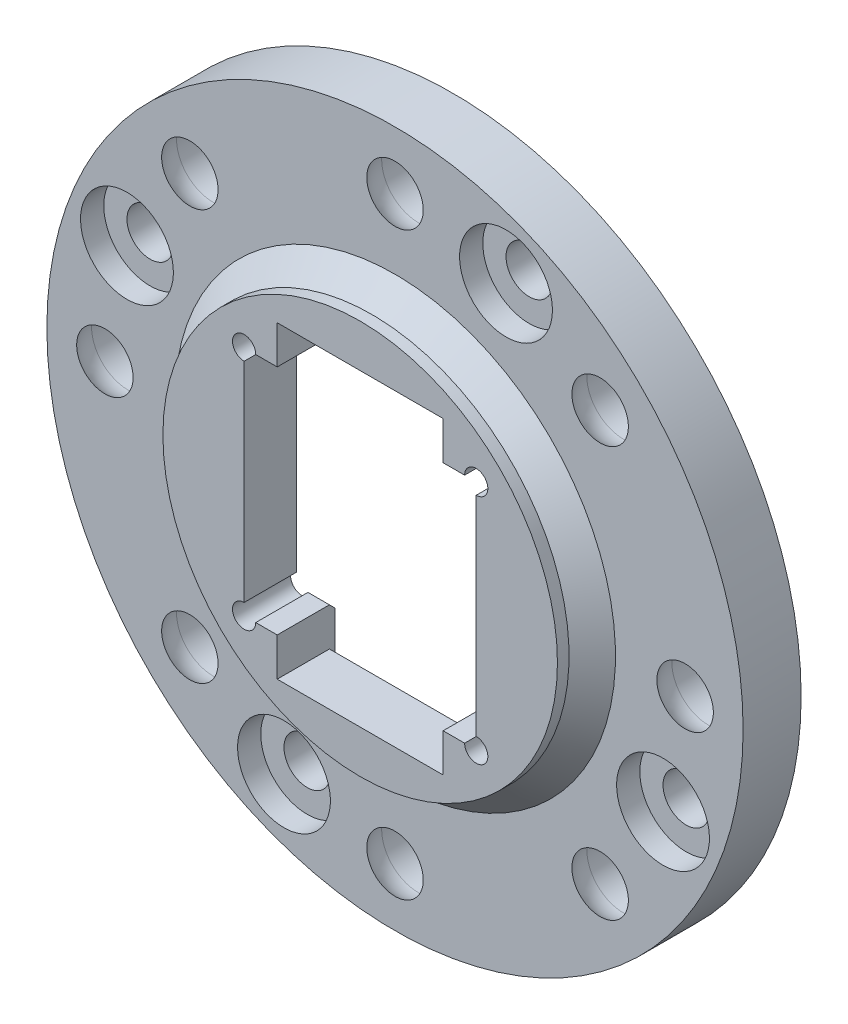
from build123d import *

# Parameters (mm, degrees)
SKETCH_1_R               = 17
EXTRUDE_1_DEPTH          = 5
SKETCH_2_R               = 30
SKETCH_2_R_2             = 17
EXTRUDE_2_DEPTH          = 2
EXTRUDE_START            = 3
SKETCH_3_R               = 30
SKETCH_3_R_2             = 20
EXTRUDE_3_DEPTH          = 3
CHAMFER_1_SIZE           = 2
PATTERN_CIRCULAR_1_COUNT = 8
SKETCH_6_R               = 4
CUT_EXTRUDE_1_DEPTH      = 2
SKETCH_7_R               = 2
CUT_EXTRUDE_2_DEPTH      = 43.720018727
PATTERN_CIRCULAR_2_COUNT = 4
CHAMFER_2_SIZE           = 0.5
CHAMFER_3_SIZE           = 3
SKETCH_8_W               = 27
SKETCH_8_H               = 3.3
CUT_EXTRUDE_3_DEPTH      = 43.720018727


with BuildPart() as part:
    # 草图1 → 凸台-拉伸1 (new body)
    with BuildSketch(Plane.XY):
        Circle(SKETCH_1_R)
        with BuildLine():
            ThreePointArc((-10, 9), (-10.707106781, 10.707106781), (-9, 10))
            Line((-9, 10), (-7.15, 10))
            Line((-7.15, 10), (-7.15, 13.3))
            Line((-7.15, 13.3), (7.15, 13.3))
            Line((7.15, 13.3), (7.15, 10))
            Line((7.15, 10), (9, 10))
            ThreePointArc((9, 10), (10, 11), (11, 10))
            ThreePointArc((11, 10), (10.707106781, 9.292893219), (10, 9))
            Line((10, 9), (10, -9))
            ThreePointArc((10, -9), (10.707106781, -9.292893219), (11, -10))
            ThreePointArc((11, -10), (10, -11), (9, -10))
            Line((9, -10), (7.15, -10))
            Line((7.15, -10), (7.15, -13.3))
            Line((7.15, -13.3), (-7.15, -13.3))
            Line((-7.15, -13.3), (-7.15, -10))
            Line((-7.15, -10), (-9, -10))
            ThreePointArc((-9, -10), (-10.707106781, -10.707106781), (-10, -9))
            Line((-10, -9), (-10, 9))
        make_face(mode=Mode.SUBTRACT)
    extrude(amount=EXTRUDE_1_DEPTH)

    # 草图2 → 凸台-拉伸2 (add)
    with BuildSketch(Plane(origin=(0, 0, 0), x_dir=(-1, 0, 0), z_dir=(0, 0, -1))):
        Circle(SKETCH_2_R)
        Circle(SKETCH_2_R_2, mode=Mode.SUBTRACT)
    extrude(amount=-EXTRUDE_2_DEPTH)

    # 草图3 → 凸台-拉伸3 (add)
    with BuildSketch(Plane(origin=(0, 0, 0), x_dir=(-1, 0, 0), z_dir=(0, 0, -1)).offset(EXTRUDE_START)):
        Circle(SKETCH_3_R)
        Circle(SKETCH_3_R_2, mode=Mode.SUBTRACT)
    extrude(amount=-EXTRUDE_3_DEPTH)

    # 倒角1
    chamfer_1_edges = [part.edges().sort_by_distance(p)[0] for p in [
        (-17, 0, 2),
    ]]
    chamfer(chamfer_1_edges, length=CHAMFER_1_SIZE)

    # 草图5 → 切除-旋转1 (revolve, cut)
    with BuildSketch(Plane(origin=(0, 0, 0), x_dir=(0, 0, -1), z_dir=(1, 0, 0)), mode=Mode.PRIVATE) as cut_revolve_1_sk:
        with BuildLine():
            Line((-3.15, 25), (3.15, 25))
            Line((3.15, 25), (3.15, 28.15))
            Line((3.15, 28.15), (0, 28.15))
            ThreePointArc((0, 28.15), (-2.227386361, 27.227386361), (-3.15, 25))
        make_face()
    cut_revolve_1 = revolve(cut_revolve_1_sk.sketch.rotate(Axis((0, 25, 998.877863865), (0, 0, -1)), 270), axis=Axis((0, 25, 998.877863865), (0, 0, -1)), mode=Mode.SUBTRACT)

    # 阵列(圆周)1: 切除-旋转1 ×8 about axis
    pattern_circular_1_axis = Axis((0, 0, 0), (0, 0, 1))
    for i in range(1, PATTERN_CIRCULAR_1_COUNT):
        add(cut_revolve_1.rotate(pattern_circular_1_axis, i * 360 / PATTERN_CIRCULAR_1_COUNT), mode=Mode.SUBTRACT)

    # 草图6 → 切除-拉伸1 (cut)
    with BuildSketch(Plane.XY.offset(2)):
        with Locations((9.567085809, 23.096988313)):
            Circle(SKETCH_6_R)
    cut_extrude_1 = extrude(amount=-CUT_EXTRUDE_1_DEPTH, mode=Mode.SUBTRACT)

    # 草图7 → 切除-拉伸2 (cut, through all)
    with BuildSketch(Plane.XY):
        with Locations((9.567085809, 23.096988313)):
            Circle(SKETCH_7_R)
    cut_extrude_2 = extrude(amount=-CUT_EXTRUDE_2_DEPTH, mode=Mode.SUBTRACT)

    # 阵列(圆周)2: 切除-拉伸1, 切除-拉伸2 ×4 about axis
    pattern_circular_2_axis = Axis((0, 0, 0), (0, 0, 1))
    add([cut_extrude_1.rotate(pattern_circular_2_axis, i * 360 / PATTERN_CIRCULAR_2_COUNT) for i in range(1, PATTERN_CIRCULAR_2_COUNT)], mode=Mode.SUBTRACT)
    add([cut_extrude_2.rotate(pattern_circular_2_axis, i * 360 / PATTERN_CIRCULAR_2_COUNT) for i in range(1, PATTERN_CIRCULAR_2_COUNT)], mode=Mode.SUBTRACT)

    # 倒角2
    chamfer_2_edges = [part.edges().sort_by_distance(p)[0] for p in [
        (10, 0, 0),
        (8.075, 10, 0),
        (0, 13.3, 0),
        (-8.075, 10, 0),
        (-10, 0, 0),
        (-8.075, -10, 0),
        (0, -13.3, 0),
        (8.075, -10, 0),
    ]]
    chamfer(chamfer_2_edges, length=CHAMFER_2_SIZE)

    # 倒角3
    chamfer_3_edges = [part.edges().sort_by_distance(p)[0] for p in [
        (20, 0, 0),
    ]]
    chamfer(chamfer_3_edges, length=CHAMFER_3_SIZE - 0.0001)  # a hair under: the kernel refuses the full size

    # 草图8 → 切除-拉伸3 (cut, through all)
    with BuildSketch(Plane(origin=(0, 0, 0), x_dir=(-1, 0, 0), z_dir=(0, 0, -1))):
        with Locations((0, 12.15)):
            Rectangle(SKETCH_8_W, SKETCH_8_H)
        with Locations((0, -12.15)):
            Rectangle(SKETCH_8_W, SKETCH_8_H)
    extrude(amount=CUT_EXTRUDE_3_DEPTH, mode=Mode.SUBTRACT)


solid = part.part
